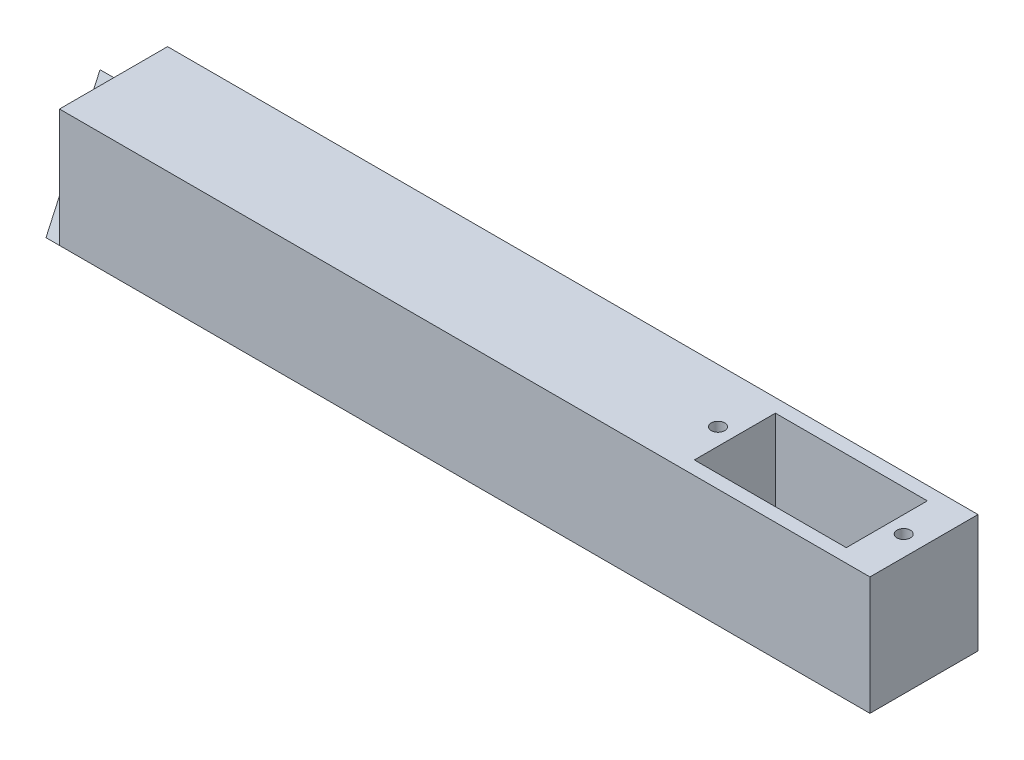
from build123d import *

# Parameters (mm, degrees)
SKIZZE1_W                       = 120
SKIZZE1_H                       = 16
SKIZZE1_W_2                     = 22.5
SKIZZE1_H_2                     = 12
AUFSATZ_LINEAR_AUSTRAGEN1_DEPTH = 17.5
AUFSATZ_LINEAR_AUSTRAGEN4_DEPTH = 2
SKIZZE4_R                       = 1
SCHNITT_LINEAR_AUSTRAGEN1_DEPTH = 85.160888652
SKIZZE6_R                       = 1
SCHNITT_LINEAR_AUSTRAGEN2_DEPTH = 14


with BuildPart() as part:
    # Skizze1 → Aufsatz-Linear austragen1 (new body)
    with BuildSketch(Plane(origin=(0, 0, 0), x_dir=(1, 0, 0), z_dir=(0, 1, 0))):
        with Locations((-19.931710459, 0)):
            Rectangle(SKIZZE1_W, SKIZZE1_H)
        with Locations((23.318289541, 0)):
            Rectangle(SKIZZE1_W_2, SKIZZE1_H_2, mode=Mode.SUBTRACT)
    extrude(amount=AUFSATZ_LINEAR_AUSTRAGEN1_DEPTH)

    # Skizze3 → Aufsatz-Linear austragen4 (add)
    with BuildSketch(Plane.ZY.offset(79.931710459)):
        Polygon((0, 17.541196026), (-8, 0), (8, 0), align=None)
    extrude(amount=AUFSATZ_LINEAR_AUSTRAGEN4_DEPTH)

    # Skizze4 → Schnitt-Linear austragen1 (cut, through all)
    with BuildSketch(Plane(origin=(0, 17.5, 0), x_dir=(1, 0, 0), z_dir=(0, 1, 0))):
        with Locations((37.068289541, 0)):
            Circle(SKIZZE4_R)
        with Locations((9.568289541, 0)):
            Circle(SKIZZE4_R)
    extrude(amount=-SCHNITT_LINEAR_AUSTRAGEN1_DEPTH, mode=Mode.SUBTRACT)

    # Skizze6 → Schnitt-Linear austragen2 (cut)
    with BuildSketch(Plane.ZY.offset(81.931710459)):
        with Locations((0.05, 5.087800905)):
            Circle(SKIZZE6_R)
    extrude(amount=-SCHNITT_LINEAR_AUSTRAGEN2_DEPTH, mode=Mode.SUBTRACT)


solid = part.part
